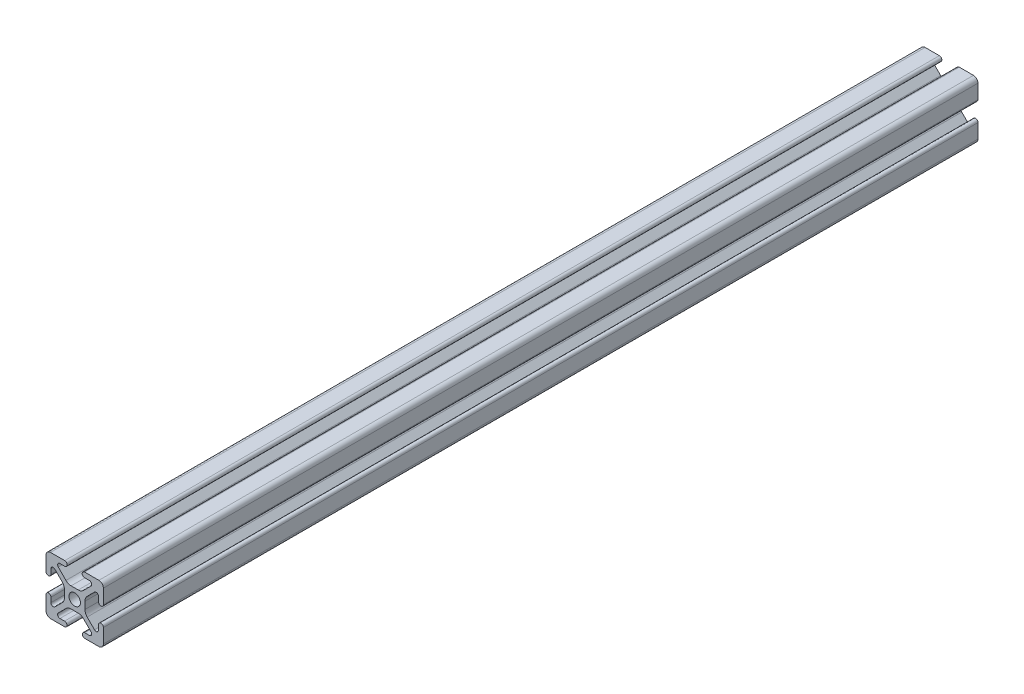
from build123d import *

# Parameters (mm, degrees)
SKETCH1_R           = 2.5
BOSS_EXTRUDE1_DEPTH = 381


with BuildPart() as part:
    # Sketch1 → Boss-Extrude1 (new body)
    with BuildSketch(Plane(origin=(0, 0, -381), x_dir=(-1, 0, 0), z_dir=(0, 0, -1))):
        with BuildLine():
            Line((12.5, 4.32), (12.5, 10.537068835))
            ThreePointArc((12.5, 10.537068835), (11.925070773, 11.925070773), (10.537068835, 12.5))
            Line((10.537068835, 12.5), (4.32, 12.5))
            ThreePointArc((4.32, 12.5), (3.25, 11.43), (4.32, 10.36))
            Line((4.32, 10.36), (6.42, 10.36))
            ThreePointArc((6.42, 10.36), (7.35325999, 9.736168088), (7.133653912, 8.635298598))
            Line((7.133653912, 8.635298598), (3.795290766, 5.301828272))
            ThreePointArc((3.795290766, 5.301828272), (2.76743922, 4.61585726), (1.555406707, 4.375))
            Line((1.555406707, 4.375), (-1.555406707, 4.375))
            ThreePointArc((-1.555406707, 4.375), (-2.76743922, 4.61585726), (-3.795290766, 5.301828272))
            Line((-3.795290766, 5.301828272), (-7.133653912, 8.635298598))
            ThreePointArc((-7.133653912, 8.635298598), (-7.35325999, 9.736168088), (-6.42, 10.36))
            Line((-6.42, 10.36), (-4.32, 10.36))
            ThreePointArc((-4.32, 10.36), (-3.25, 11.43), (-4.32, 12.5))
            Line((-4.32, 12.5), (-10.537068835, 12.5))
            ThreePointArc((-10.537068835, 12.5), (-11.925070773, 11.925070773), (-12.5, 10.537068835))
            Line((-12.5, 10.537068835), (-12.5, 4.32))
            ThreePointArc((-12.5, 4.32), (-11.43, 3.25), (-10.36, 4.32))
            Line((-10.36, 4.32), (-10.36, 6.396886949))
            ThreePointArc((-10.36, 6.396886949), (-9.736852394, 7.329863489), (-8.636346088, 7.111588351))
            Line((-8.636346088, 7.111588351), (-5.432204773, 3.912143135))
            ThreePointArc((-5.432204773, 3.912143135), (-4.708985779, 2.831057106), (-4.455, 1.555406707))
            Line((-4.455, 1.555406707), (-4.455, -1.555406707))
            ThreePointArc((-4.455, -1.555406707), (-4.708985779, -2.831057106), (-5.432204773, -3.912143135))
            Line((-5.432204773, -3.912143135), (-8.636346088, -7.111588351))
            ThreePointArc((-8.636346088, -7.111588351), (-9.736852394, -7.329863489), (-10.36, -6.396886949))
            Line((-10.36, -6.396886949), (-10.36, -4.32))
            ThreePointArc((-10.36, -4.32), (-11.43, -3.25), (-12.5, -4.32))
            Line((-12.5, -4.32), (-12.5, -10.537068835))
            ThreePointArc((-12.5, -10.537068835), (-11.925070773, -11.925070773), (-10.537068835, -12.5))
            Line((-10.537068835, -12.5), (-4.387856959, -12.5))
            ThreePointArc((-4.387856959, -12.5), (-3.317856959, -11.43), (-4.387856959, -10.36))
            Line((-4.387856959, -10.36), (-6.42, -10.36))
            ThreePointArc((-6.42, -10.36), (-7.35325999, -9.736168088), (-7.133653912, -8.635298598))
            Line((-7.133653912, -8.635298598), (-3.795290766, -5.301828272))
            ThreePointArc((-3.795290766, -5.301828272), (-2.76743922, -4.61585726), (-1.555406707, -4.375))
            Line((-1.555406707, -4.375), (1.555406707, -4.375))
            ThreePointArc((1.555406707, -4.375), (2.76743922, -4.61585726), (3.795290766, -5.301828272))
            Line((3.795290766, -5.301828272), (7.133653912, -8.635298598))
            ThreePointArc((7.133653912, -8.635298598), (7.35325999, -9.736168088), (6.42, -10.36))
            Line((6.42, -10.36), (4.387856959, -10.36))
            ThreePointArc((4.387856959, -10.36), (3.317856959, -11.43), (4.387856959, -12.5))
            Line((4.387856959, -12.5), (10.537068835, -12.5))
            ThreePointArc((10.537068835, -12.5), (11.925070773, -11.925070773), (12.5, -10.537068835))
            Line((12.5, -10.537068835), (12.5, -4.32))
            ThreePointArc((12.5, -4.32), (11.43, -3.25), (10.36, -4.32))
            Line((10.36, -4.32), (10.36, -6.396886949))
            ThreePointArc((10.36, -6.396886949), (9.736852394, -7.329863489), (8.636346088, -7.111588351))
            Line((8.636346088, -7.111588351), (5.432204773, -3.912143135))
            ThreePointArc((5.432204773, -3.912143135), (4.708985779, -2.831057106), (4.455, -1.555406707))
            Line((4.455, -1.555406707), (4.455, 1.555406707))
            ThreePointArc((4.455, 1.555406707), (4.708985779, 2.831057106), (5.432204773, 3.912143135))
            Line((5.432204773, 3.912143135), (8.636346088, 7.111588351))
            ThreePointArc((8.636346088, 7.111588351), (9.736852394, 7.329863489), (10.36, 6.396886949))
            Line((10.36, 6.396886949), (10.36, 4.32))
            ThreePointArc((10.36, 4.32), (11.43, 3.25), (12.5, 4.32))
        make_face()
        Circle(SKETCH1_R, mode=Mode.SUBTRACT)
    extrude(amount=-BOSS_EXTRUDE1_DEPTH)


solid = part.part
